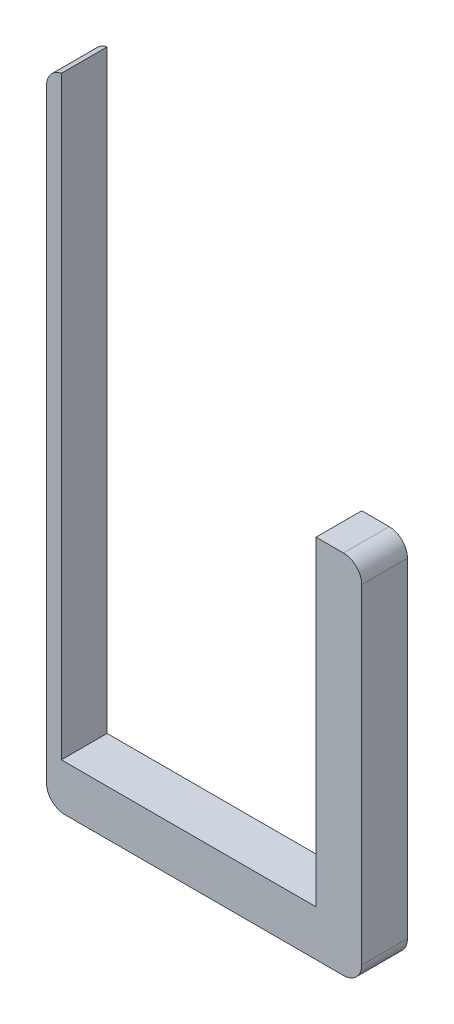
from build123d import *

# Parameters (mm, degrees)
BOSS_EXTRUDE1_DEPTH = 6.35
FILLET1_R           = 2.54


with BuildPart() as part:
    # Sketch1 → Boss-Extrude1 (new body)
    with BuildSketch(Plane.XY):
        Polygon((0, 0), (35.3568, 0), (35.3568, 44.45), (41.7068, 44.45), (41.7068, -6.35), (-2.0574, -6.35), (-2.0574, 82.55), (0, 82.55), align=None)
    extrude(amount=BOSS_EXTRUDE1_DEPTH)

    # Fillet1
    # the kernel refuses this fillet: 2.54 mm, written as the material it takes off along each edge
    with BuildSketch(Plane(origin=(41.7068, 44.45, -6.35), x_dir=(-1, 0, 0), z_dir=(0, 0, 1)), Plane(origin=(-2.0574, -6.35, -6.35), x_dir=(1, 0, 0), z_dir=(0, 0, 1)), Plane(origin=(41.7068, -6.35, -6.35), x_dir=(0, 1, 0), z_dir=(0, 0, 1))) as fillet1_piece_1:
        with BuildLine():
            CenterArc((FILLET1_R, FILLET1_R), FILLET1_R, 180, 90)
            Line((0, FILLET1_R), (-FILLET1_R * 0.02, FILLET1_R))
            Line((-FILLET1_R * 0.02, FILLET1_R), (-FILLET1_R * 0.02, -FILLET1_R * 0.02))
            Line((-FILLET1_R * 0.02, -FILLET1_R * 0.02), (FILLET1_R, -FILLET1_R * 0.02))
            Line((FILLET1_R, -FILLET1_R * 0.02), (FILLET1_R, 0))
        make_face()
    extrude(amount=19.05, mode=Mode.SUBTRACT)
    with BuildSketch(Plane(origin=(-2.0574, 82.55, -6.234328974), x_dir=(0, -1, 0), z_dir=(0, 0, 1))) as fillet1_piece_2:
        with BuildLine():
            CenterArc((2.493731589, 2.54), FILLET1_R, 190.952784199, 79.047215801)
            Line((0, 2.0574), (-0.049874632, 2.047748))
            ThreePointArc((-0.049874632, 2.047748), (-0.0508, 1.0287), (-0.0508, 0))
            Line((-0.0508, 0), (0, -0.0508))
            Line((0, -0.0508), (2.493731589, -0.0508))
            Line((2.493731589, -0.0508), (2.493731589, 0))
        make_face()
    extrude(amount=18.818657947, mode=Mode.SUBTRACT)


solid = part.part
